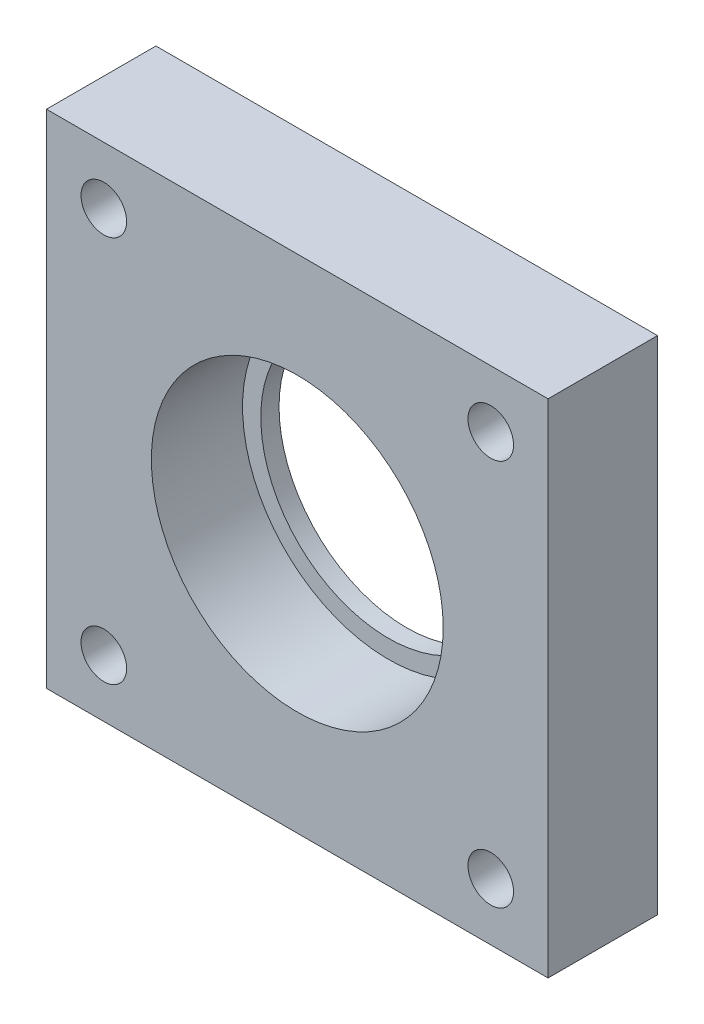
from build123d import *

# Parameters (mm, degrees)
SCHIZZO1_W                   = 55
SCHIZZO1_H                   = 55
ESTRUSIONE_ESTRUSIONE1_DEPTH = 12
SCHIZZO2_R                   = 16
TAGLIO_ESTRUSIONE1_DEPTH     = 10
SCHIZZO3_R                   = 14
TAGLIO_ESTRUSIONE2_DEPTH     = 10
SCHIZZO4_R                   = 2.5
TAGLIO_ESTRUSIONE3_DEPTH     = 79.70196948


with BuildPart() as part:
    # Schizzo1 → Estrusione-Estrusione1 (new body)
    with BuildSketch(Plane.XY):
        with Locations((27.5, 27.5)):
            Rectangle(SCHIZZO1_W, SCHIZZO1_H)
    extrude(amount=-ESTRUSIONE_ESTRUSIONE1_DEPTH)

    # Schizzo2 → Taglio-Estrusione1 (cut)
    with BuildSketch(Plane.XY):
        with Locations((27.5, 27.5)):
            Circle(SCHIZZO2_R)
    extrude(amount=-TAGLIO_ESTRUSIONE1_DEPTH, mode=Mode.SUBTRACT)

    # Schizzo3 → Taglio-Estrusione2 (cut)
    with BuildSketch(Plane.XY.offset(-10)):
        with Locations((27.5, 27.5)):
            Circle(SCHIZZO3_R)
    extrude(amount=-TAGLIO_ESTRUSIONE2_DEPTH, mode=Mode.SUBTRACT)

    # Schizzo4 → Taglio-Estrusione3 (cut, through all)
    with BuildSketch(Plane(origin=(0, 0, -12), x_dir=(-1, 0, 0), z_dir=(0, 0, -1))):
        with Locations((-48.713203436, 48.713203436)):
            Circle(SCHIZZO4_R)
        with Locations((-6.286796564, 48.713203436)):
            Circle(SCHIZZO4_R)
        with Locations((-48.713203436, 6.286796564)):
            Circle(SCHIZZO4_R)
        with Locations((-6.286796564, 6.286796564)):
            Circle(SCHIZZO4_R)
    extrude(amount=-TAGLIO_ESTRUSIONE3_DEPTH, mode=Mode.SUBTRACT)


solid = part.part
